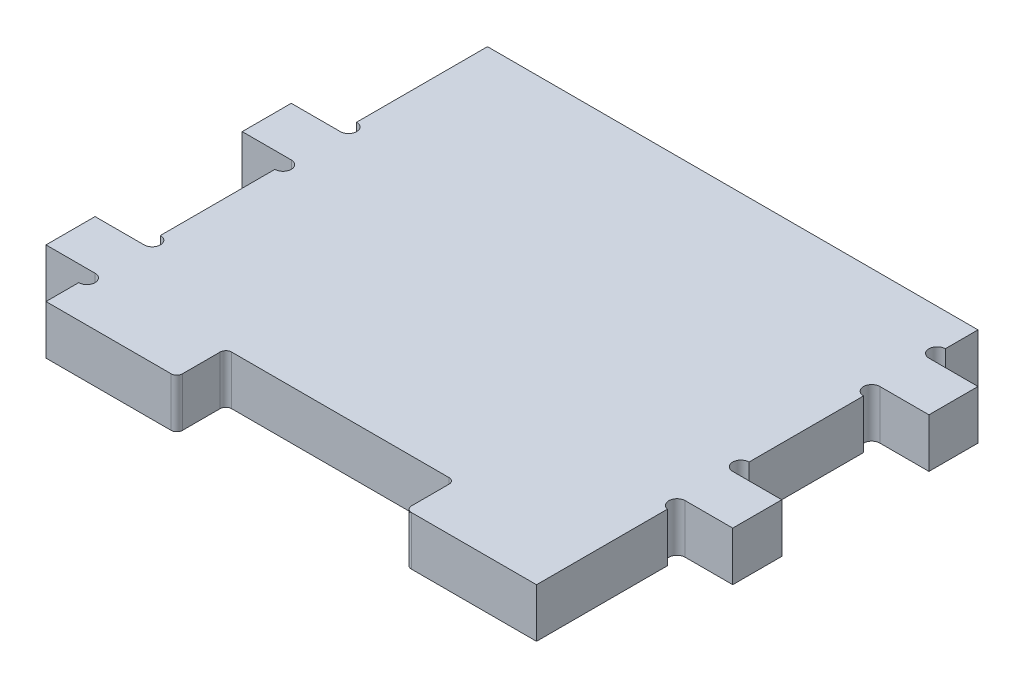
from build123d import *

# Parameters (mm, degrees)
BOSS_EXTRUDE1_DEPTH = 19.05
FILLET1_R           = 2.2225


with BuildPart() as part:
    # Sketch1 → Boss-Extrude1 (new body)
    with BuildSketch(Plane(origin=(0, 0, 0), x_dir=(1, 0, 0), z_dir=(0, 1, 0))):
        with BuildLine():
            Line((190.5, 171.45), (0, 171.45))
            Line((0, 171.45), (0, 120.65))
            ThreePointArc((0, 120.65), (3.175, 117.475), (0, 114.3))
            Line((0, 114.3), (-19.05, 114.3))
            Line((-19.05, 114.3), (-19.05, 95.25))
            Line((-19.05, 95.25), (0, 95.25))
            ThreePointArc((0, 95.25), (3.175, 92.075), (0, 88.9))
            Line((0, 88.9), (0, 44.45))
            ThreePointArc((0, 44.45), (3.175, 41.275), (0, 38.1))
            Line((0, 38.1), (-19.05, 38.1))
            Line((-19.05, 38.1), (-19.05, 19.05))
            Line((-19.05, 19.05), (0, 19.05))
            ThreePointArc((0, 19.05), (3.175, 15.875), (0, 12.7))
            Line((0, 12.7), (0, 0))
            Line((0, 0), (50.8, 0))
            Line((50.8, 0), (50.8, 19.05))
            Line((50.8, 19.05), (139.7, 19.05))
            Line((139.7, 19.05), (139.7, 0))
            Line((139.7, 0), (190.5, 0))
            Line((190.5, 0), (190.5, 50.855736572))
            ThreePointArc((190.5, 50.855736572), (187.931266017, 54.272458919), (191.092301163, 57.15))
            Line((191.092301163, 57.15), (209.55, 57.15))
            Line((209.55, 57.15), (209.55, 76.2))
            Line((209.55, 76.2), (190.5, 76.2))
            ThreePointArc((190.5, 76.2), (187.325, 79.375), (190.5, 82.55))
            Line((190.5, 82.55), (190.5, 127))
            ThreePointArc((190.5, 127), (187.325, 130.175), (190.5, 133.35))
            Line((190.5, 133.35), (209.55, 133.35))
            Line((209.55, 133.35), (209.55, 152.4))
            Line((209.55, 152.4), (190.5, 152.4))
            ThreePointArc((190.5, 152.4), (187.325, 155.575), (190.5, 158.75))
            Line((190.5, 158.75), (190.5, 171.45))
        make_face()
    extrude(amount=BOSS_EXTRUDE1_DEPTH)

    # Fillet1
    fillet1_edges = [part.edges().sort_by_distance(p)[0] for p in [
        (139.7, 9.525, 0),
        (139.7, 9.525, -19.05),
        (50.8, 9.525, -19.05),
        (50.8, 9.525, 0),
    ]]
    fillet(fillet1_edges, radius=FILLET1_R)


solid = part.part
